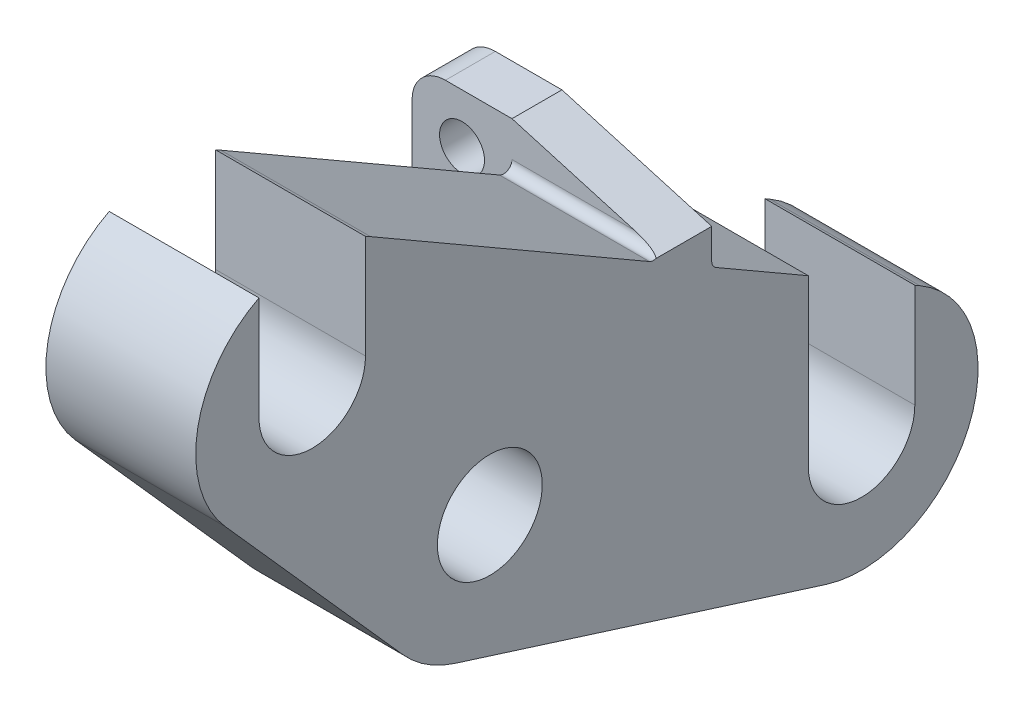
from build123d import *

# Parameters (mm, degrees)
SKETCH1_R                       = 3.15
BOSS_EXTRUDE1_DEPTH             = 9
BOSS_EXTRUDE2_DEPTH             = 6
BOSS_EXTRUDE2_DIRECTION_2_REACH = 244.867
SKETCH3_R                       = 1.35
CUT_EXTRUDE1_DEPTH              = 242.551945874
CHAMFER1_SIZE                   = 6
CHAMFER1_SIZE_2                 = 10
CHAMFER2_SIZE                   = 2.6
CHAMFER2_SIZE2                  = 9
FILLET1_R                       = 2
FILLET2_R                       = 0.5
FILLET3_R                       = 0.5
FILLET4_R                       = 1


with BuildPart() as part:
    # Sketch1 → Boss-Extrude1 (new body)
    with BuildSketch(Plane(origin=(9, 0, 0), x_dir=(0, 0, -1), z_dir=(1, 0, 0))):
        with BuildLine():
            Line((3.523521467, 220.170630859), (3.223774703, 220.343673039))
            Line((3.223774703, 220.343673039), (3.223774703, 214.108306834))
            ThreePointArc((3.223774703, 214.108306834), (0.023774703, 210.908306834), (-3.176225297, 214.108306834))
            Line((-3.176225297, 214.108306834), (-3.176225297, 224.038358312))
            Line((-3.176225297, 224.038358312), (-29.477274378, 239.221811231))
            ThreePointArc((-29.477274378, 239.221811231), (-29.626151265, 239.305353383), (-29.777021142, 239.385240172))
            Line((-29.777021142, 239.385240172), (-29.777021142, 233.159487206))
            ThreePointArc((-29.777021142, 233.159487206), (-32.977021142, 229.959487206), (-36.177021142, 233.159487206))
            Line((-36.177021142, 233.159487206), (-36.177021142, 239.385240172))
            ThreePointArc((-36.177021142, 239.385240172), (-39.85809233, 234.444344903), (-38.208056262, 228.508006627))
            Line((-38.208056262, 228.508006627), (-27.537554982, 216.508006627))
            ThreePointArc((-27.537554982, 216.508006627), (-26.112876869, 215.284825825), (-24.414305812, 214.484366354))
            Line((-24.414305812, 214.484366354), (-2.084011246, 207.433185982))
            ThreePointArc((-2.084011246, 207.433185982), (6.430412997, 211.287848401), (3.523521467, 220.170630859))
        make_face()
        with Locations(Location((-22.306519862, 221.159487206, 0), (0, 0, 180))):
            Circle(SKETCH1_R, mode=Mode.SUBTRACT)
    extrude(amount=-BOSS_EXTRUDE1_DEPTH)

    # Sketch2 → Boss-Extrude2 (add)
    with BuildSketch(Plane.ZY):
        Polygon((8.976225297, 232.108306834), (11.976225297, 232.108306834), (11.976225297, 210.556825276), (8.976225297, 209.609522899), align=None)
    extrude(amount=BOSS_EXTRUDE2_DEPTH)

    # Boss-Extrude2 direction 2: up to this face of the body (flat: up to its plane)
    boss_extrude2_direction_2_end = Plane(part.part.faces().sort_by_distance((9, 222.248813277, 17.342130355))[0])
    # Sketch2 → Boss-Extrude2 direction 2 (add, up to the picked face)
    with BuildSketch(Plane.ZY, mode=Mode.PRIVATE) as boss_extrude2_direction_2_sk1:
        Polygon((8.976225297, 232.108306834), (11.976225297, 232.108306834), (11.976225297, 210.556825276), (8.976225297, 209.609522899), align=None)
    boss_extrude2_direction_2_tool1 = split(extrude(boss_extrude2_direction_2_sk1.sketch, amount=-BOSS_EXTRUDE2_DIRECTION_2_REACH, mode=Mode.PRIVATE), bisect_by=boss_extrude2_direction_2_end, keep=Keep.BOTH, mode=Mode.PRIVATE)
    add(boss_extrude2_direction_2_tool1.solids().sort_by(Axis((0, 221.094043, 10.465473), (1, 0, 0)))[0])

    # Sketch3 → Cut-Extrude1 (cut, through all)
    with BuildSketch(Plane(origin=(0, 0, 8.976225297), x_dir=(-1, 0, 0), z_dir=(0, 0, -1))):
        with Locations(Location((3, 229.108306834, 0), (0, 0, 90))):
            Circle(SKETCH3_R)
    extrude(amount=-CUT_EXTRUDE1_DEPTH, mode=Mode.SUBTRACT)

    # Chamfer1
    # the kernel refuses this chamfer: 10, 6 mm, written as the material it takes off along each edge
    with BuildSketch(Plane(origin=(-6, 218.344374993, 36.638518695), x_dir=(0.9984760801092615, -0.05262494307091041, 0.016617244549774337), z_dir=(0, -0.3011122785042559, -0.9535886931659664))) as chamfer1_piece_1:
        Polygon((CHAMFER1_SIZE * 0.998476080109, -CHAMFER1_SIZE * 0.0551862070598), (-CHAMFER1_SIZE_2 * 0.0551862070598, -CHAMFER1_SIZE_2 * 0.998476080109), (0, 0), align=None)
    extrude(amount=54.8712324, mode=Mode.SUBTRACT)

    # Chamfer2
    chamfer2_edges = [part.edges().sort_by_distance(p)[0] for p in [
        (9, 232.108306834, 10.476225297),
    ]]
    chamfer2_side = [part.faces().sort_by_distance(p)[0] for p in [
        (9, 222.390108053, 17.217310228),
    ]]
    chamfer(chamfer2_edges, length=CHAMFER2_SIZE, length2=CHAMFER2_SIZE2, reference=chamfer2_side[0])

    # Fillet1
    fillet1_edges = [part.edges().sort_by_distance(p)[0] for p in [
        (-6, 232.108306834, 10.476225297),
    ]]
    fillet(fillet1_edges, radius=FILLET1_R)

    # Fillet2
    fillet2_edges = [part.edges().sort_by_distance(p)[0] for p in [
        (4.5, 227.38666684, 8.976225297),
    ]]
    fillet(fillet2_edges, radius=FILLET2_R)

    # Fillet3
    fillet3_edges = [part.edges().sort_by_distance(p)[0] for p in [
        (4.5, 229.118550561, 11.976225297),
    ]]
    fillet(fillet3_edges, radius=FILLET3_R)

    # Fillet4
    fillet4_edges = [part.edges().sort_by_distance(p)[0] for p in [
        (0, 218.642439399, 8.976225297),
    ]]
    fillet(fillet4_edges, radius=FILLET4_R)


solid = part.part
